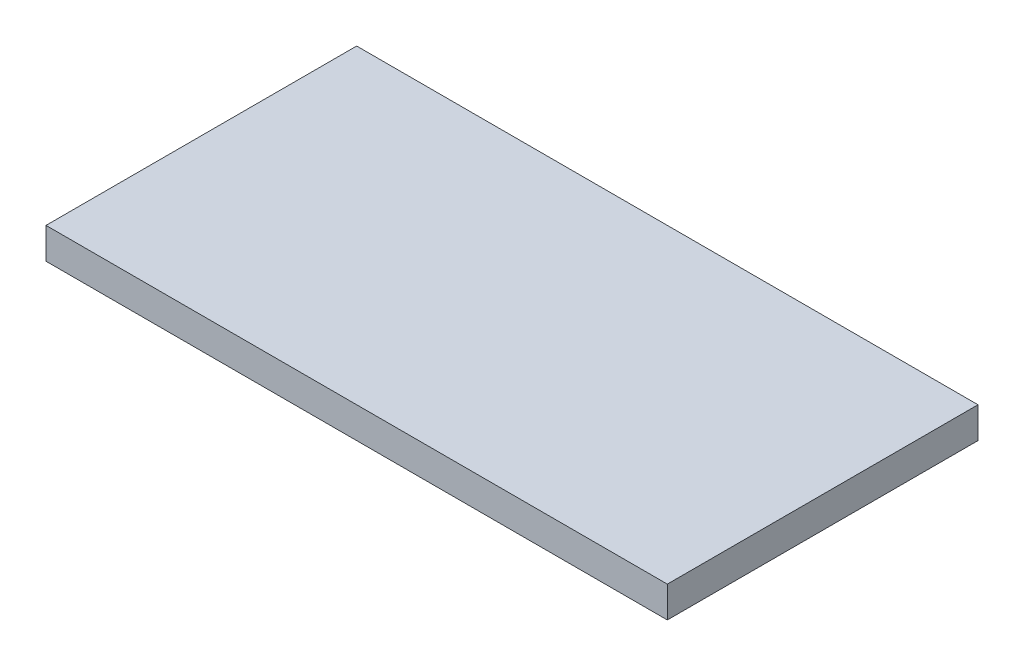
from build123d import *

# Parameters (mm, degrees)
SKETCH1_W          = 101.6
SKETCH1_H          = 50.8
BASE_FLANGE1_DEPTH = 5.08


# Sheet-metal steps are written as plain solids
with BuildPart() as part:
    # Sketch1 → Base-Flange1 (new body)
    with BuildSketch(Plane(origin=(0, 0, 0), x_dir=(1, 0, 0), z_dir=(0, 1, 0))):
        Rectangle(SKETCH1_W, SKETCH1_H)
    extrude(amount=-BASE_FLANGE1_DEPTH)


solid = part.part
